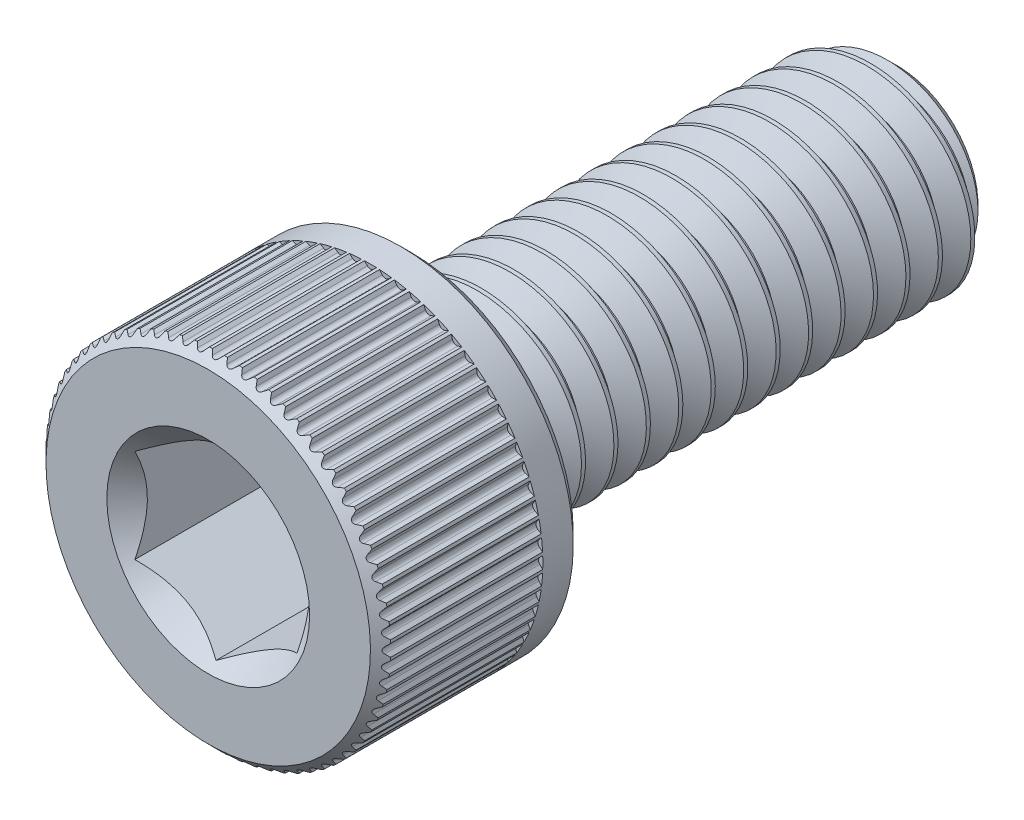
from build123d import *

# Parameters (mm, degrees)
CUT_EXTRUDE1_DEPTH     = 4
SPLIT1_SURFACE_1_BACK  = 21.821
SPLIT1_SURFACE_1_DEPTH = 43.642
SPLIT1_SURFACE_2_BACK  = 21.821
SPLIT1_SURFACE_2_DEPTH = 43.642
CUT_SWEEP1_PITCH       = 0.8
CUT_SWEEP1_TO          = 11.75
CUT_EXTRUDE3_DEPTH     = 4
CIRPATTERN1_COUNT      = 72


with BuildPart() as part:
    # Sketch2 → Revolve1 (revolve)
    with BuildSketch(Plane(origin=(0, 0, 0), x_dir=(0, 0, -1), z_dir=(1, 0, 0))):
        with BuildLine():
            Line((-8.5, 0), (-8.5, 4))
            Line((-8.5, 4), (-8.25, 4.25))
            Line((-8.25, 4.25), (-3.75, 4.25))
            Line((-3.75, 4.25), (-3.5, 4))
            Line((-3.5, 4), (-3.5, 2.75))
            ThreePointArc((-3.5, 2.75), (-3.426776695, 2.573223305), (-3.25, 2.5))
            Line((-3.25, 2.5), (7.980384758, 2.5))
            Line((7.980384758, 2.5), (8.5, 1.980384758))
            Line((8.5, 1.980384758), (8.5, 0))
            Line((8.5, 0), (-8.5, 0))
        make_face()
    revolve(axis=Axis((0, 0, -8.5), (0, 0, 1)))

    # Sketch3 → Cut-Extrude1 (cut)
    with BuildSketch(Plane.XY.offset(8.5)):
        Polygon((2, -1.154700538), (2, 1.154700538), (0, 2.309401077), (-2, 1.154700538), (-2, -1.154700538), (0, -2.309401077), align=None)
    extrude(amount=-CUT_EXTRUDE1_DEPTH, mode=Mode.SUBTRACT)

    # Cut-Extrude2 cone 1 section (through the dimple's axis) → Cut-Extrude2 (revolve, cut)
    with BuildSketch(Plane(origin=(0, 0, 8.5), x_dir=(0, -1, 0), z_dir=(1, 0, 0))):
        Polygon((0, 0), (2.5, 0), (0, 2.5), align=None)
    revolve(axis=Axis((0, 0, 8.5), (0, 0, -1)), mode=Mode.SUBTRACT)


with BuildPart() as body_2:
    # Split1: the piece behind the surface
    add(part.part)
    # Split1 surface: a surface, the sketch's curves swept straight by 43.642 mm
    with BuildLine(Plane(origin=(0, 0, 0), x_dir=(0, 0, -1), z_dir=(1, 0, 0)).offset(-SPLIT1_SURFACE_1_BACK), mode=Mode.PRIVATE) as split1_surface_1_path:
        Line((-3.25, -4.25), (-3.25, 4.25))
    split1_surface_1 = Shell.extrude(split1_surface_1_path.wire(), (1 * SPLIT1_SURFACE_1_DEPTH, 0 * SPLIT1_SURFACE_1_DEPTH, 0 * SPLIT1_SURFACE_1_DEPTH))
    split(bisect_by=split1_surface_1, keep=Keep.BOTTOM)

    # Cut-Sweep1: arcs per turn and ends read off the stored shape
    # Cut-Sweep1: the profile of Sketch7 screwed along a right-hand helix through 16 turns, 8 arcs to a turn; built about Z, then put on its axis
    cut_sweep1_z = Axis((0, 0, 0), (0, 0, 1))
    cut_sweep1_corners = [(2.54330127, 0, 0.025), (2.54330127, 0, -0.725), (1.980384758, 0, -0.4), (1.980384758, 0, -0.3)]
    with BuildLine(mode=Mode.PRIVATE) as cut_sweep1_profile:
        Line(cut_sweep1_corners[0], cut_sweep1_corners[1])
        Line(cut_sweep1_corners[1], cut_sweep1_corners[2])
        Line(cut_sweep1_corners[2], cut_sweep1_corners[3])
        Line(cut_sweep1_corners[3], cut_sweep1_corners[0])
    cut_sweep1_cap = Face(cut_sweep1_profile.wire())
    cut_sweep1_turn_angles = [0, 22.5, 45, 67.5, 90, 112.5, 135, 157.5, 180, 202.5, 225, 247.5, 270, 292.5, 315, 337.5, 360]
    cut_sweep1_turn_weights = [1, 0.9238795325112867, 1, 0.9238795325112867, 1, 0.9238795325112867, 1, 0.9238795325112867, 1, 0.9238795325112867, 1, 0.9238795325112867, 1, 0.9238795325112867, 1, 0.9238795325112867, 1]
    cut_sweep1_turn_rails = [Edge.make_bspline([Vector(p[0], p[1], 0).rotate(cut_sweep1_z, cut_sweep1_turn_angles[k]) / cut_sweep1_turn_weights[k] + Vector(0, 0, p[2] + CUT_SWEEP1_PITCH * cut_sweep1_turn_angles[k] / 360) for k in range(17)], [0, 0, 0, 1, 1, 2, 2, 3, 3, 4, 4, 5, 5, 6, 6, 7, 7, 8, 8, 8], 2, cut_sweep1_turn_weights) for p in cut_sweep1_corners]
    cut_sweep1_turn_sides = [Face.make_surface_from_curves(cut_sweep1_turn_rails[p[0]], cut_sweep1_turn_rails[p[1]]) for p in [(0, 1), (1, 2), (2, 3), (3, 0)]]
    cut_sweep1 = Plane(origin=(0, 0, -8.5), x_dir=(0, 1, 0), z_dir=(0, 0, 1)) * split(Solid(Shell([*[p.moved(Location((0, 0, CUT_SWEEP1_PITCH * i))) for i in range(16) for p in cut_sweep1_turn_sides], cut_sweep1_cap, cut_sweep1_cap.rotate(cut_sweep1_z, 5760).moved(Location((0, 0, CUT_SWEEP1_PITCH * 5760 / 360)))])), bisect_by=Plane.XY.offset(CUT_SWEEP1_TO), keep=Keep.BOTTOM, mode=Mode.PRIVATE)
    add(cut_sweep1, mode=Mode.SUBTRACT)


with BuildPart() as part_1:
    add(part.part)

    # Split1: split by a surface, the side it looks to stays
    # Split1 surface: a surface, the sketch's curves swept straight by 43.642 mm
    with BuildLine(Plane(origin=(0, 0, 0), x_dir=(0, 0, -1), z_dir=(1, 0, 0)).offset(-SPLIT1_SURFACE_2_BACK), mode=Mode.PRIVATE) as split1_surface_2_path:
        Line((-3.25, -4.25), (-3.25, 4.25))
    split1_surface_2 = Shell.extrude(split1_surface_2_path.wire(), (1 * SPLIT1_SURFACE_2_DEPTH, 0 * SPLIT1_SURFACE_2_DEPTH, 0 * SPLIT1_SURFACE_2_DEPTH))
    split(bisect_by=split1_surface_2, keep=Keep.TOP)

    add(body_2.part)  # Revolve2 merges body 2
    # Sketch8 → Revolve2 (revolve)
    with BuildSketch(Plane(origin=(0, 0, 0), x_dir=(0, 0, -1), z_dir=(1, 0, 0)), mode=Mode.PRIVATE) as revolve2_sk:
        Polygon((-3.5, 0), (-3.5, 2.5), (-3.25, 2.5), (-1.806624327, 0), align=None)
    revolve(revolve2_sk.sketch.rotate(Axis((0, 0, 1.806624327), (0, 0, 1)), 270), axis=Axis((0, 0, 1.806624327), (0, 0, 1)))

    # Sketch12 → Cut-Extrude3 (cut)
    with BuildSketch(Plane.XY.offset(8.5)):
        with BuildLine():
            Line((-0.257161846, 4.35625), (0.257161846, 4.35625))
            Line((0.257161846, 4.35625), (0.07624254, 4.175330694))
            ThreePointArc((0.07624254, 4.175330694), (0, 4.14375), (-0.07624254, 4.175330694))
            Line((-0.07624254, 4.175330694), (-0.257161846, 4.35625))
        make_face()
    cut_extrude3 = extrude(amount=-CUT_EXTRUDE3_DEPTH, mode=Mode.SUBTRACT)

    # CirPattern1: Cut-Extrude3 ×72 about axis
    cirpattern1_axis = Axis((0, 0, 0), (0, 0, 1))
    for i in range(1, CIRPATTERN1_COUNT):
        add(cut_extrude3.rotate(cirpattern1_axis, i * 360 / CIRPATTERN1_COUNT), mode=Mode.SUBTRACT)


solid = part_1.part
